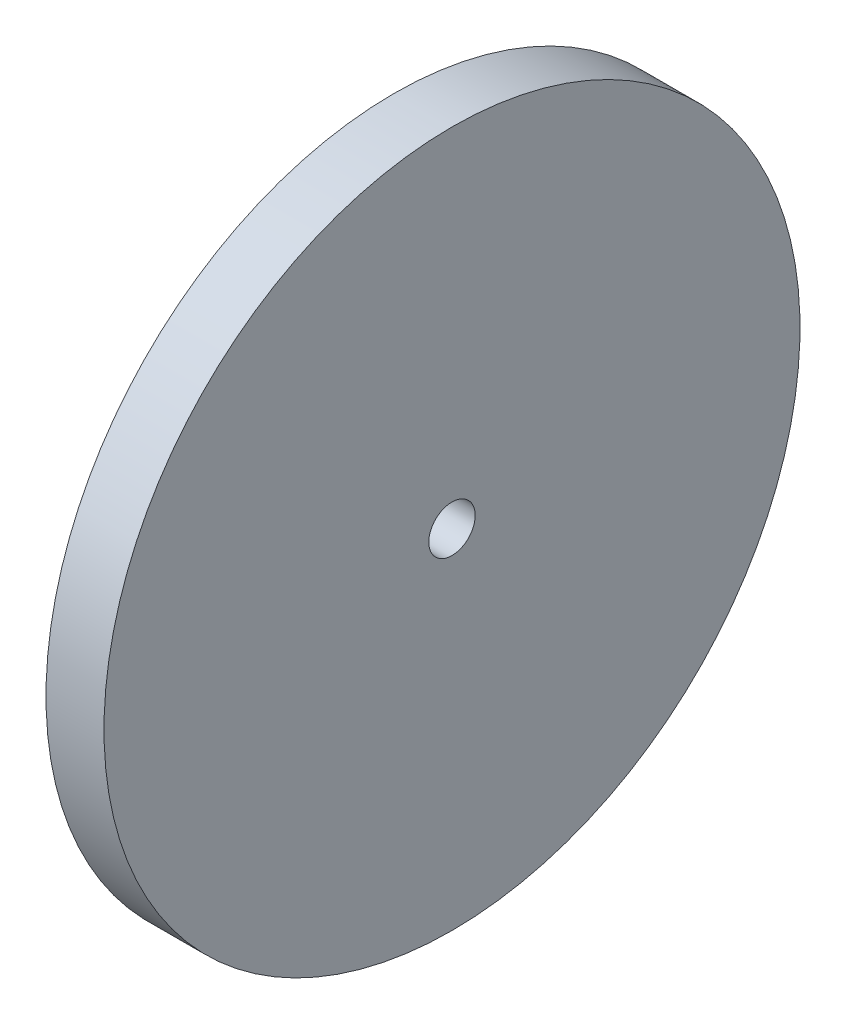
from build123d import *

# Parameters (mm, degrees)
SKETCH2_R          = 1
CUT_EXTRUDE1_DEPTH = 33.787192622
CUT_EXTRUDE2_START = -22.5
SKETCH3_R          = 15
CUT_EXTRUDE2_DEPTH = 22.5


with BuildPart() as part:
    # Sketch1 → Revolve1 (revolve)
    with BuildSketch(Plane.XY):
        with BuildLine():
            Line((-12.5, 15), (-12.5, 0))
            Line((-12.5, 0), (12.5, 0))
            Line((12.5, 0), (12.5, 15))
            Line((12.5, 15), (10, 15))
            ThreePointArc((10, 15), (0, 5), (-10, 15))
            Line((-10, 15), (-12.5, 15))
        make_face()
    revolve(axis=Axis((-12.5, 0, 0), (1, 0, 0)))

    # Sketch2 → Cut-Extrude1 (cut, through all)
    with BuildSketch(Plane(origin=(12.5, 0, 0), x_dir=(0, 0, -1), z_dir=(1, 0, 0))):
        Circle(SKETCH2_R)
    extrude(amount=-CUT_EXTRUDE1_DEPTH, mode=Mode.SUBTRACT)

    # Sketch3 → Cut-Extrude2 (cut)
    with BuildSketch(Plane(origin=(12.5, 0, 0), x_dir=(0, 0, -1), z_dir=(1, 0, 0)).offset(CUT_EXTRUDE2_START)):
        Circle(SKETCH3_R)
    extrude(amount=CUT_EXTRUDE2_DEPTH, mode=Mode.SUBTRACT)


solid = part.part
